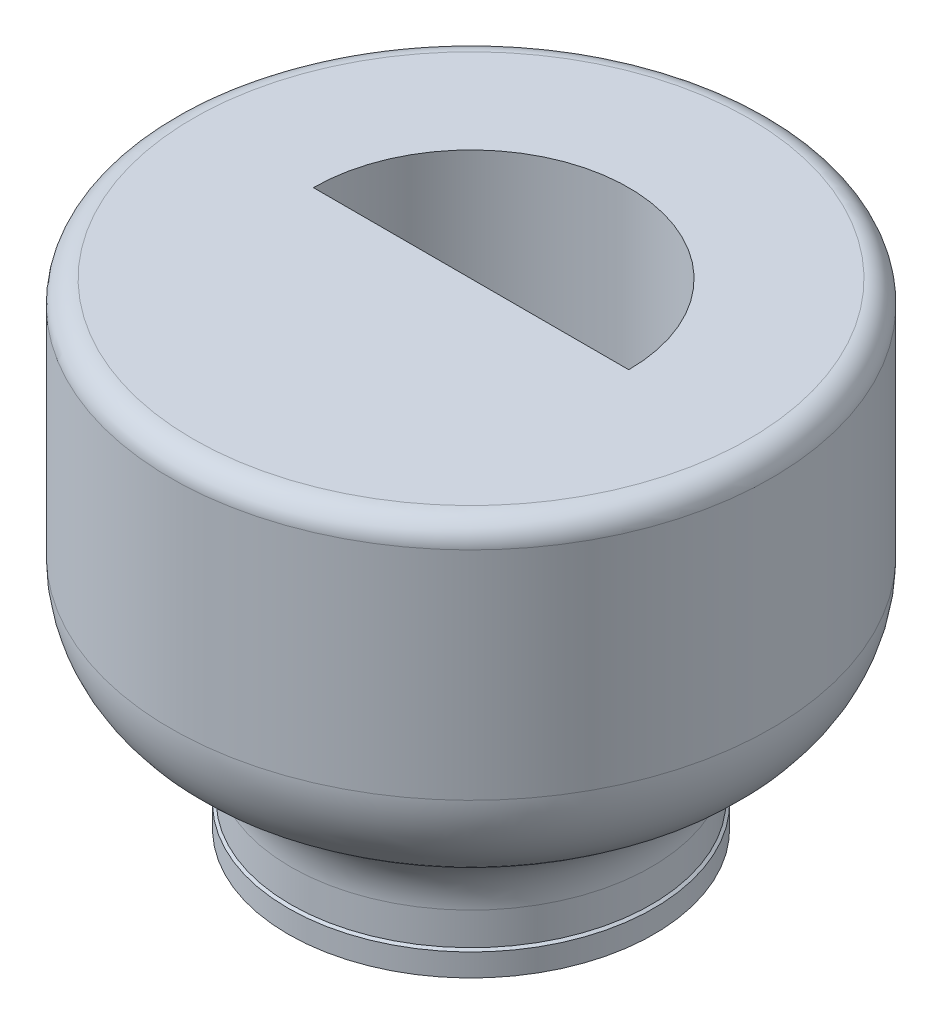
from build123d import *

# Parameters (mm, degrees)
CUT_EXTRUDE3_DEPTH      = 60
CUT_EXTRUDE5_DEPTH      = 2
CUT_EXTRUDE5_DEPTH_BACK = 15


with BuildPart() as part:
    # Sketch1 → Revolve1 (revolve)
    with BuildSketch(Plane.XY):
        with BuildLine():
            Line((0, 63.427876097), (37, 63.427876097))
            ThreePointArc((37, 63.427876097), (39.121320344, 62.54919644), (40, 60.427876097))
            Line((40, 60.427876097), (40, 31.556288966))
            ThreePointArc((40, 31.556288966), (38.188122658, 24.409721904), (33.190210564, 18.989648567))
            Line((33.190210564, 18.989648567), (28.539859624, 15.958818353))
            ThreePointArc((28.539859624, 15.958818353), (25.207918228, 12.345436129), (24, 7.581058088))
            Line((24, 7.581058088), (24, 3.25))
            Line((24, 3.25), (24.35, 3))
            Line((24.35, 3), (24.35, 0))
            Line((24.35, 0), (22.5, 0))
            Line((22.5, 0), (22.5, 12.5))
            ThreePointArc((22.5, 12.5), (22.353553391, 12.853553391), (22, 13))
            Line((22, 13), (0, 13))
            Line((0, 13), (0, 63.427876097))
        make_face()
    revolve(axis=Axis((0, 0, 0), (0, 1, 0)))

    # Sketch11 → Cut-Extrude3 (cut)
    with BuildSketch(Plane(origin=(0, 13, 0), x_dir=(-1, 0, 0), z_dir=(0, -1, 0))):
        with BuildLine():
            Line((-21, 0), (21, 0))
            ThreePointArc((21, 0), (0, 21), (-21, 0))
        make_face()
    extrude(amount=-CUT_EXTRUDE3_DEPTH, mode=Mode.SUBTRACT)

    # Sketch9 → Cut-Extrude5 (cut, two sides: drawn at the far end of the back side and taken through both)
    with BuildSketch(Plane(origin=(0, 60.427876097, 0), x_dir=(1, 0, 0), z_dir=(0, 1, 0)).offset(-CUT_EXTRUDE5_DEPTH_BACK)):
        with BuildLine():
            ThreePointArc((-37, -1.601545046), (-0.376939953, -37.002145429), (37, -2.398454954))
            ThreePointArc((37, -2.398454954), (0.42119799, 37.111888235), (-37, -1.601545046))
        make_face()
        with BuildLine():
            Line((-22, -1.763080838), (22, -2.236919162))
            ThreePointArc((22, -2.236919162), (0.283876608, 24.360406363), (-22, -1.763080838))
        make_face(mode=Mode.SUBTRACT)
    extrude(amount=CUT_EXTRUDE5_DEPTH + CUT_EXTRUDE5_DEPTH_BACK, mode=Mode.SUBTRACT)


solid = part.part
